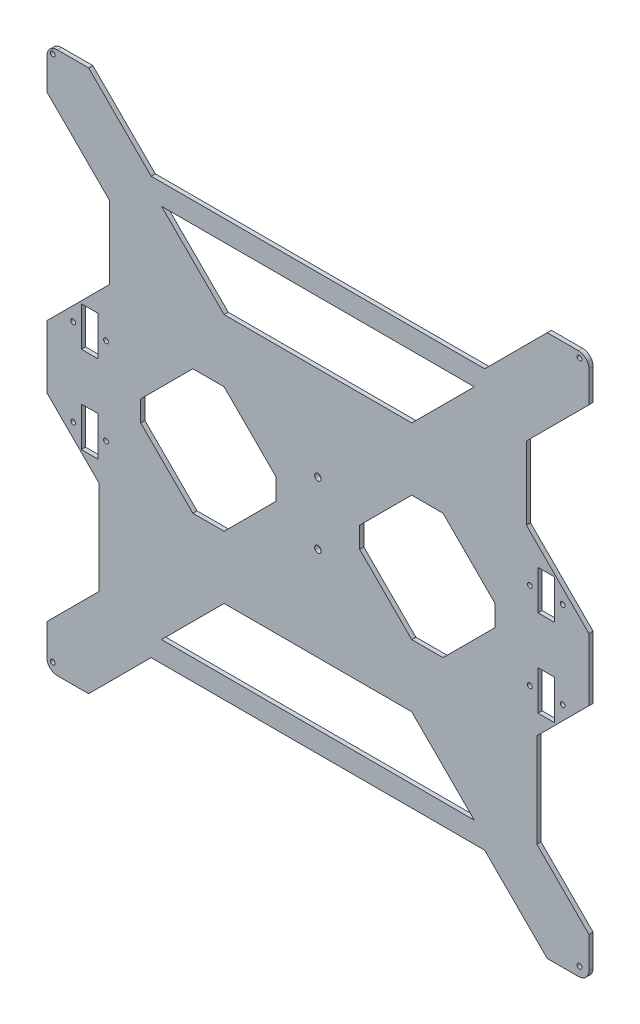
from build123d import *

# Parameters (mm, degrees)
MODEL_R             = 1.4605
MODEL_R_2           = 2
BOSS_EXTRUDE1_DEPTH = 1.27
SKETCH1_W           = 10
SKETCH1_H           = 24
CUT_EXTRUDE1_DEPTH  = 10


with BuildPart() as part:
    # Model → Boss-Extrude1 (new, symmetric)
    with BuildSketch(Plane.XY):
        with BuildLine():
            Line((-290.681304326, 108.4317), (-252.581304326, 70.3317))
            Line((-252.581304326, 70.3317), (-252.581304326, 25.8817))
            Line((-252.581304326, 25.8817), (-290.681304326, -12.2183))
            Line((-290.681304326, -12.2183), (-290.681304326, -50.3183))
            Line((-290.681304326, -50.3183), (-258.931304326, -82.0683))
            Line((-258.931304326, -82.0683), (-258.931304326, -139.2183))
            Line((-258.931304326, -139.2183), (-290.681304326, -170.9683))
            Line((-290.681304326, -170.9683), (-290.681304326, -190.0183))
            ThreePointArc((-290.681304326, -190.0183), (-288.821432386, -194.508428061), (-284.331304326, -196.3683))
            Line((-284.331304326, -196.3683), (-265.281304326, -196.3683))
            Line((-265.281304326, -196.3683), (-227.181304326, -158.2683))
            Line((-227.181304326, -158.2683), (-23.981304326, -158.2683))
            Line((-23.981304326, -158.2683), (14.118695674, -196.3683))
            Line((14.118695674, -196.3683), (33.168695674, -196.3683))
            ThreePointArc((33.168695674, -196.3683), (37.658823735, -194.508428061), (39.518695674, -190.0183))
            Line((39.518695674, -190.0183), (39.518695674, -170.9683))
            Line((39.518695674, -170.9683), (7.768695674, -139.2183))
            Line((7.768695674, -139.2183), (7.768695674, -82.0683))
            Line((7.768695674, -82.0683), (22.457936385, -67.37905929))
            Line((22.457936385, -67.37905929), (39.518695674, -50.3183))
            Line((39.518695674, -50.3183), (39.518695674, -12.2183))
            Line((39.518695674, -12.2183), (1.418695674, 25.8817))
            Line((1.418695674, 25.8817), (1.418695674, 70.3317))
            Line((1.418695674, 70.3317), (39.518695674, 108.4317))
            Line((39.518695674, 108.4317), (39.518695674, 127.4817))
            ThreePointArc((39.518695674, 127.4817), (37.658823735, 131.971828061), (33.168695674, 133.8317))
            Line((33.168695674, 133.8317), (14.118695674, 133.8317))
            Line((14.118695674, 133.8317), (-23.981304326, 95.7317))
            Line((-23.981304326, 95.7317), (-227.181304326, 95.7317))
            Line((-227.181304326, 95.7317), (-265.281304326, 133.8317))
            Line((-265.281304326, 133.8317), (-284.331304326, 133.8317))
            ThreePointArc((-284.331304326, 133.8317), (-288.821432386, 131.971828061), (-290.681304326, 127.4817))
            Line((-290.681304326, 127.4817), (-290.681304326, 108.4317))
        make_face()
        with Locations((-287.125304326, -190.6025)):
            Circle(MODEL_R, mode=Mode.SUBTRACT)
        Polygon((-68.431304326, -107.4683), (-30.331304326, -145.5683), (-220.831304326, -145.5683), (-182.731304326, -107.4683), align=None, mode=Mode.SUBTRACT)
        with Locations((-274.681304256, -57.7288)):
            Circle(MODEL_R, mode=Mode.SUBTRACT)
        with Locations((-254.681304256, -57.7288)):
            Circle(MODEL_R, mode=Mode.SUBTRACT)
        with Locations((-125.581304326, -50.3183)):
            Circle(MODEL_R_2, mode=Mode.SUBTRACT)
        with Locations((33.752895674, -190.6025)):
            Circle(MODEL_R, mode=Mode.SUBTRACT)
        with Locations((3.518695604, -57.7288)):
            Circle(MODEL_R, mode=Mode.SUBTRACT)
        with Locations((23.518695604, -57.7288)):
            Circle(MODEL_R, mode=Mode.SUBTRACT)
        with Locations((-274.681304256, -4.8078)):
            Circle(MODEL_R, mode=Mode.SUBTRACT)
        with Locations((-254.681304256, -4.8078)):
            Circle(MODEL_R, mode=Mode.SUBTRACT)
        Polygon((-182.731304326, -69.3683), (-201.781304326, -69.3683), (-233.531304326, -37.6183), (-233.531304326, -24.9183), (-201.781304326, 6.8317), (-182.731304326, 6.8317), (-150.981304326, -24.9183), (-150.981304326, -37.6183), align=None, mode=Mode.SUBTRACT)
        with Locations((-125.581304326, -12.2183)):
            Circle(MODEL_R_2, mode=Mode.SUBTRACT)
        with Locations((-287.125304326, 130.2757)):
            Circle(MODEL_R, mode=Mode.SUBTRACT)
        Polygon((-182.731304326, 44.9317), (-220.831304326, 83.0317), (-30.331304326, 83.0317), (-68.431304326, 44.9317), align=None, mode=Mode.SUBTRACT)
        Polygon((-68.431304326, -69.3683), (-100.181304326, -37.6183), (-100.181304326, -24.9183), (-68.431304326, 6.8317), (-49.381304326, 6.8317), (-17.631304326, -24.9183), (-17.631304326, -37.6183), (-49.381304326, -69.3683), align=None, mode=Mode.SUBTRACT)
        with Locations((3.518695604, -4.8078)):
            Circle(MODEL_R, mode=Mode.SUBTRACT)
        with Locations((23.518695604, -4.8078)):
            Circle(MODEL_R, mode=Mode.SUBTRACT)
        with Locations((33.752895674, 130.2757)):
            Circle(MODEL_R, mode=Mode.SUBTRACT)
    extrude(amount=BOSS_EXTRUDE1_DEPTH, both=True)

    # Sketch1 → Cut-Extrude1 (cut)
    with BuildSketch(Plane.XY.offset(1.27)):
        with Locations((-264.681304256, -57.7288)):
            Rectangle(SKETCH1_W, SKETCH1_H)
        with Locations((-264.681304256, -4.8078)):
            Rectangle(SKETCH1_W, SKETCH1_H)
        with Locations((13.518695604, -4.8078)):
            Rectangle(SKETCH1_W, SKETCH1_H)
        with Locations((13.518695604, -57.7288)):
            Rectangle(SKETCH1_W, SKETCH1_H)
    extrude(amount=-CUT_EXTRUDE1_DEPTH, mode=Mode.SUBTRACT)


solid = part.part
